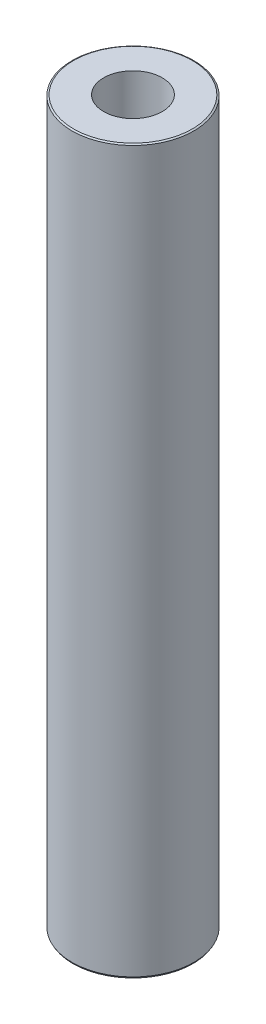
from build123d import *
from OCP.BRepFilletAPI import BRepFilletAPI_MakeChamfer

# Parameters (mm, degrees)
SKETCH1_R           = 20
BOSS_EXTRUDE1_DEPTH = 237.13182639
SKETCH2_R           = 9.620642253
CUT_EXTRUDE1_DEPTH  = 239.812694568
CHAMFER1_SIZE       = 0.301002055
CHAMFER1_SIZE2      = 0.521350852


with BuildPart() as part:
    # Sketch1 → Boss-Extrude1 (new body)
    with BuildSketch(Plane(origin=(0, 0, 0), x_dir=(1, 0, 0), z_dir=(0, 1, 0))):
        Circle(SKETCH1_R)
    extrude(amount=BOSS_EXTRUDE1_DEPTH)

    # Sketch2 → Cut-Extrude1 (cut, through all)
    with BuildSketch(Plane(origin=(0, 0, 0), x_dir=(1, 0, 0), z_dir=(0, 1, 0))):
        Circle(SKETCH2_R)
    extrude(amount=CUT_EXTRUDE1_DEPTH, mode=Mode.SUBTRACT)

    # Chamfer1: one chamfer whose edges measure the first distance from different faces: ONE call of the kernel's chamfer builder (chamfer() names one face for all edges)
    chamfer1_edges_1 = [part.edges().sort_by_distance(p)[0] for p in [
        (-20, 237.13182639, 0),
    ]]
    chamfer1_side_1 = [part.faces().sort_by_distance(p)[0] for p in [
        (-20, 118.565913195, 0),
    ]]
    chamfer1_edges_2 = [part.edges().sort_by_distance(p)[0] for p in [
        (-20, 0, 0),
    ]]
    chamfer1_side_2 = [part.faces().sort_by_distance(p)[0] for p in [
        (-19.434314575, 0, 0),
    ]]
    chamfer1 = BRepFilletAPI_MakeChamfer(part.part.solid().wrapped)
    for e in chamfer1_edges_1:
        chamfer1.Add(CHAMFER1_SIZE, CHAMFER1_SIZE2, e.wrapped, chamfer1_side_1[0].wrapped)  # the first distance lies on this face
    for e in chamfer1_edges_2:
        chamfer1.Add(CHAMFER1_SIZE, CHAMFER1_SIZE2, e.wrapped, chamfer1_side_2[0].wrapped)  # the first distance lies on this face
    add(Compound.cast(chamfer1.Shape()), mode=Mode.REPLACE)


solid = part.part
